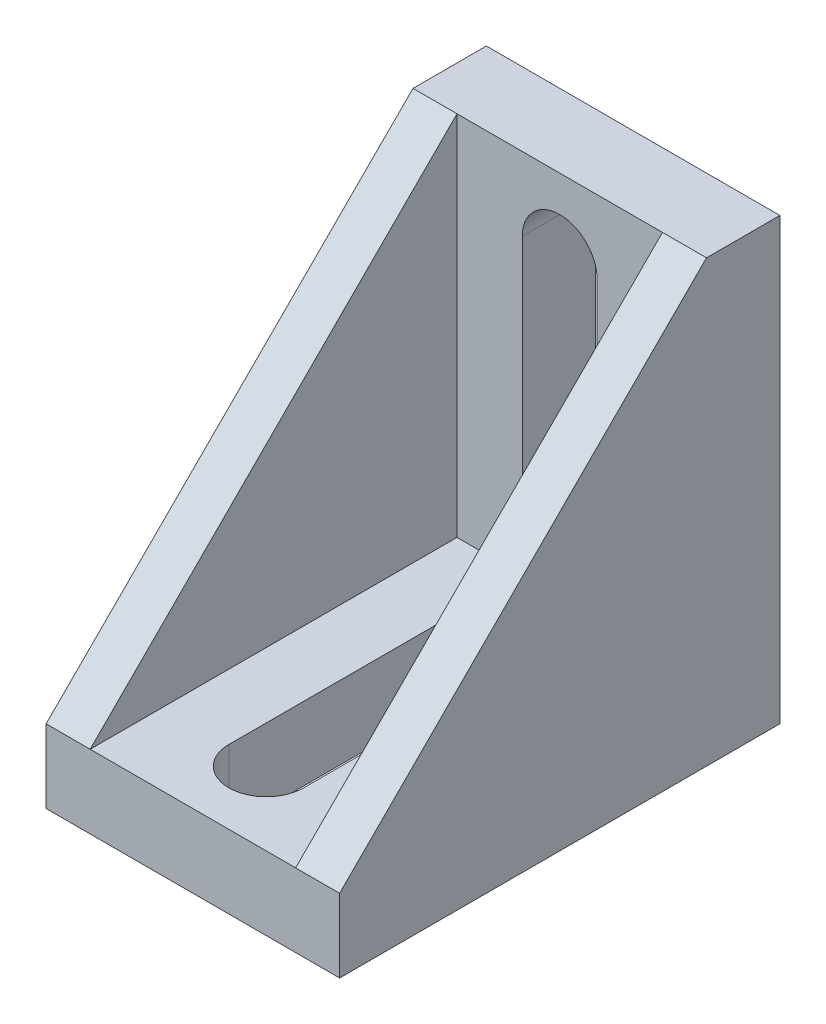
from build123d import *

# Parameters (mm, degrees)
ESQUISSE1_W                  = 20
ESQUISSE1_H                  = 30
BOSS_EXTRU_1_DEPTH           = 30
COQUE1_START                 = 3
COQUE1_OUTLINE_W             = 25
COQUE1_OUTLINE_H             = 25
COQUE1_DEPTH                 = 14
ENL_V_MAT_EXTRU_1_DEPTH      = 47.904157598
ENL_V_MAT_EXTRU_1_DEPTH_BACK = 47.904157598
ENL_V_MAT_EXTRU_2_DEPTH      = 44.874821937
R_P_TITION_CIRCULAIRE1_COUNT = 2
R_P_TITION_CIRCULAIRE1_ANGLE = 270


# Read off the part's stored shape, not the designer's step: Coque1
with BuildPart() as part:
    # Esquisse1 → Boss.-Extru.1 (new body)
    with BuildSketch(Plane.XY):
        with Locations((10, 15)):
            Rectangle(ESQUISSE1_W, ESQUISSE1_H)
    extrude(amount=BOSS_EXTRU_1_DEPTH)

    # Coque1 outline → Coque1 (cut)
    with BuildSketch(Plane.YZ.offset(COQUE1_START)):
        with Locations((17.5, 17.5)):
            Rectangle(COQUE1_OUTLINE_W, COQUE1_OUTLINE_H)
    extrude(amount=COQUE1_DEPTH, mode=Mode.SUBTRACT)

    # Esquisse3 → Enlèv. mat.-Extru.1 (cut, two sides: drawn at the far end of the back side and taken through both)
    with BuildSketch(Plane(origin=(20, 0, 0), x_dir=(0, 0, -1), z_dir=(1, 0, 0)).offset(-ENL_V_MAT_EXTRU_1_DEPTH_BACK)):
        Polygon((-5, 30), (-30, 30), (-30, 5), align=None)
    extrude(amount=ENL_V_MAT_EXTRU_1_DEPTH + ENL_V_MAT_EXTRU_1_DEPTH_BACK, mode=Mode.SUBTRACT)

    # Esquisse5 → Enlèv. mat.-Extru.2 (cut, symmetric)
    with BuildSketch(Plane.XY.offset(5)):
        with BuildLine():
            Line((12.5525, 25), (12.5525, 10))
            ThreePointArc((12.5525, 10), (10, 7.4475), (7.4475, 10))
            Line((7.4475, 10), (7.4475, 25))
            ThreePointArc((7.4475, 25), (10, 27.5525), (12.5525, 25))
        make_face()
    enl_v_mat_extru_2 = extrude(amount=ENL_V_MAT_EXTRU_2_DEPTH, both=True, mode=Mode.SUBTRACT)

    # Répétition circulaire1: Enlèv. mat.-Extru.2 ×2 about axis
    r_p_tition_circulaire1_axis = Axis((0, 5, 5), (-1, 0, 0))
    for i in range(1, R_P_TITION_CIRCULAIRE1_COUNT):
        add(enl_v_mat_extru_2.rotate(r_p_tition_circulaire1_axis, i * R_P_TITION_CIRCULAIRE1_ANGLE / (R_P_TITION_CIRCULAIRE1_COUNT - 1)), mode=Mode.SUBTRACT)


solid = part.part
